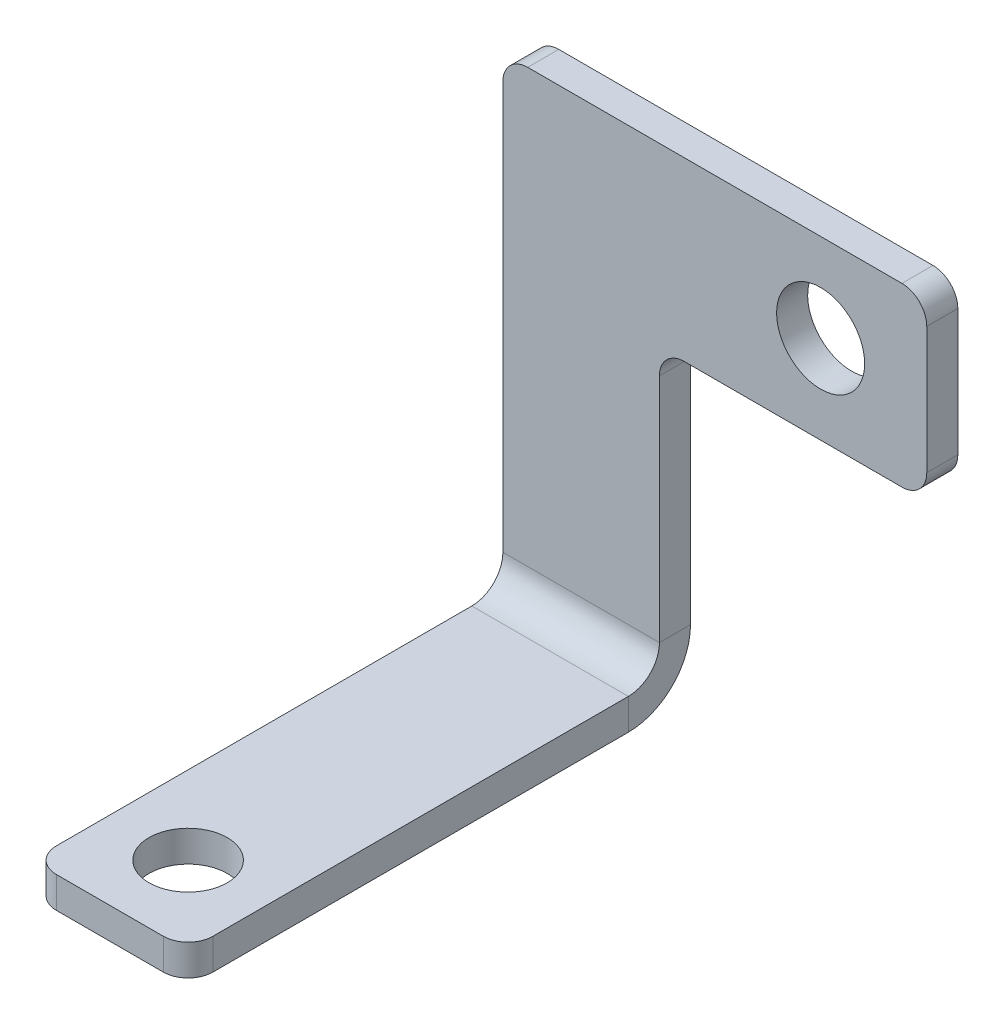
from build123d import *

# Parameters (mm, degrees)
SKETCH1_W                    = 16
SKETCH1_H                    = 48.167640012
SKETCH1_R                    = 4
BOSS_EXTRUDE1_DEPTH          = 3.175
EDGE_FLANGE1_STRIP_W         = 19.05
EDGE_FLANGE1_STRIP_H         = 3.175
EDGE_FLANGE1_STRIP_CUT_DEPTH = 16
EDGE_FLANGE1_DEPTH           = 16
EDGE_FLANGE1_START           = 3.175
EDGE_FLANGE1_FLAT_DEPTH      = 3.175
SKETCH11_R                   = 3.7210804
CUT_EXTRUDE1_DEPTH           = 81.232501141
M8_CLEARANCE_HOLE1_D         = 9
FILLET1_R                    = 2.54


# Sheet-metal steps are written as plain solids
with BuildPart() as part:
    # Sketch1 → Boss-Extrude1 (new body)
    with BuildSketch(Plane(origin=(0, 0, 0), x_dir=(1, 0, 0), z_dir=(0, 1, 0))):
        with Locations((0, 16.083820006)):
            Rectangle(SKETCH1_W, SKETCH1_H)
        with Locations(Location((0, 0, 0), (0, 0, 270))):
            Circle(SKETCH1_R, mode=Mode.SUBTRACT)
    extrude(amount=BOSS_EXTRUDE1_DEPTH)

    # Edge-Flange1 strip (across the edge) → Edge-Flange1 strip cut (cut)
    with BuildSketch(Plane(origin=(8, 3.175, -40.167640012), x_dir=(0, 0, 1), z_dir=(-1, 0, 0))):
        with Locations((-6.35, -1.5875)):
            Rectangle(EDGE_FLANGE1_STRIP_W, EDGE_FLANGE1_STRIP_H)
    extrude(amount=EDGE_FLANGE1_STRIP_CUT_DEPTH, mode=Mode.SUBTRACT)

    # Edge-Flange1 bend section (across the edge) → Edge-Flange1 (add)
    with BuildSketch(Plane(origin=(8, 3.175, -40.167640012), x_dir=(0, 0, 1), z_dir=(-1, 0, 0))):
        with BuildLine():
            Line((-3.175, 3.175), (0, 3.175))
            ThreePointArc((0, 3.175), (0.92993597, 0.92993597), (3.175, 0))
            Line((3.175, 0), (3.175, -3.175))
            ThreePointArc((3.175, -3.175), (-1.315128061, -1.315128061), (-3.175, 3.175))
        make_face()
    extrude(amount=EDGE_FLANGE1_DEPTH)

    # Edge-Flange1 profile (on flange) → Edge-Flange1 flat (add)
    with BuildSketch(Plane(origin=(0, 3.175, -40.167640012), x_dir=(-1, 0, 0), z_dir=(0, 0, -1)).offset(EDGE_FLANGE1_START)):
        Polygon((8, 3.175), (8, 47.359), (-8, 47.359), (-27.7, 47.359), (-35.32, 47.359), (-35.32, 29.325), (-27.7, 29.325), (-8, 29.325), (-8, 3.175), align=None)
    extrude(amount=-EDGE_FLANGE1_FLAT_DEPTH)

    # Sketch11 → Cut-Extrude1 (cut, through all)
    with BuildSketch(Plane(origin=(0, 0, -43.342640012), x_dir=(-1, 0, 0), z_dir=(0, 0, -1))):
        with Locations(Location((-24.4742, 41.517, 0), (0, 0, 90))):
            Circle(SKETCH11_R)
    extrude(amount=-CUT_EXTRUDE1_DEPTH, mode=Mode.SUBTRACT)

    # M8 Clearance Hole1 (through all)
    with Locations(Plane(origin=(0, 0, -43.342640012), x_dir=(-1, 0, 0), z_dir=(0, 0, -1))):
        with Locations((-24.4742, 41.517)):
            Hole(M8_CLEARANCE_HOLE1_D / 2)

    # Fillet1
    fillet1_edges = [part.edges().sort_by_distance(p)[0] for p in [
        (8, 32.5, -41.755140012),
        (-8, 50.534, -41.755140012),
        (35.32, 50.534, -41.755140012),
        (35.32, 32.5, -41.755140012),
        (8, 1.5875, 8),
        (-8, 1.5875, 8),
    ]]
    fillet(fillet1_edges, radius=FILLET1_R)


solid = part.part
